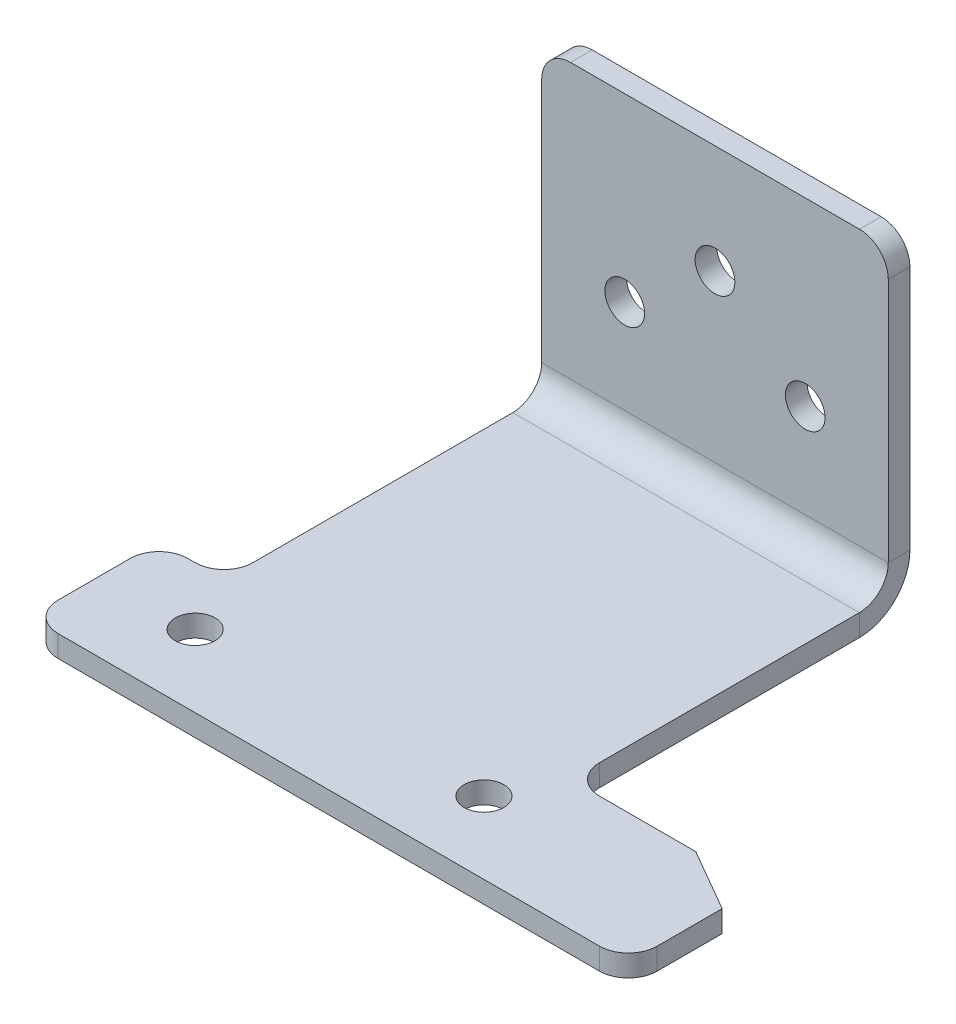
from build123d import *

# Parameters (mm, degrees)
ODGI_CIE_BAZOWE1_DEPTH     = 50
SZKIC6_W                   = 26
SZKIC6_H                   = 47
WYTNIJ_WYCI_GNI_CIE1_DEPTH = 94.541434669
OTW_R_POD_RUB_M51_D        = 5.5
OTW_R_POD_RUB_M52_D        = 5.5
SZKIC11_W                  = 17
SZKIC11_H                  = 18
WYTNIJ_WYCI_GNI_CIE2_DEPTH = 93.135769384
SFAZOWANIE1_SIZE           = 5
SFAZOWANIE1_SIZE2          = 8.660254038
ZAOKR_GLENIE1_R            = 4


# Sheet-metal steps are written as plain solids
with BuildPart() as part:
    # Szkic1 → Odgięcie bazowe1 (new, symmetric)
    with BuildSketch(Plane(origin=(0, 0, 0), x_dir=(0, 0, -1), z_dir=(1, 0, 0))):
        with BuildLine():
            Line((-65, 0), (-7, 0))
            ThreePointArc((-7, 0), (-2.050252532, 2.050252532), (0, 7))
            Line((0, 7), (0, 45))
            Line((0, 45), (-3, 45))
            Line((-3, 45), (-3, 7))
            ThreePointArc((-3, 7), (-4.171572875, 4.171572875), (-7, 3))
            Line((-7, 3), (-65, 3))
            Line((-65, 3), (-65, 0))
        make_face()
    extrude(amount=ODGI_CIE_BAZOWE1_DEPTH, both=True)

    # Szkic6 → Wytnij-wyciągnięcie1 (cut, through all)
    with BuildSketch(Plane.XZ):
        with Locations((37, 23.5)):
            Rectangle(SZKIC6_W, SZKIC6_H)
        with Locations((-37, 23.5)):
            Rectangle(SZKIC6_W, SZKIC6_H)
    extrude(amount=-WYTNIJ_WYCI_GNI_CIE1_DEPTH, mode=Mode.SUBTRACT)

    # Otwór pod śrubę M51 (through all)
    with Locations(Plane(origin=(0, 0, 0), x_dir=(-1, 0, 0), z_dir=(0, 0, -1))):
        with Locations((0, 30), (-12.5, 20), (12.5, 20)):
            Hole(OTW_R_POD_RUB_M51_D / 2)

    # Otwór pod śrubę M52 (through all)
    with Locations(Plane(origin=(0, 0, 0), x_dir=(-1, 0, 0), z_dir=(0, -1, 0))):
        with Locations((20, -55), (-20, -55)):
            Hole(OTW_R_POD_RUB_M52_D / 2)

    # Szkic11 → Wytnij-wyciągnięcie2 (cut, through all)
    with BuildSketch(Plane(origin=(0, 3, 0), x_dir=(1, 0, 0), z_dir=(0, 1, 0))):
        with Locations((-41.5, -56)):
            Rectangle(SZKIC11_W, SZKIC11_H)
    extrude(amount=-WYTNIJ_WYCI_GNI_CIE2_DEPTH, mode=Mode.SUBTRACT)

    # Sfazowanie1
    sfazowanie1_edges = [part.edges().sort_by_distance(p)[0] for p in [
        (50, 1.5, 47),
    ]]
    sfazowanie1_side = [part.faces().sort_by_distance(p)[0] for p in [
        (50, 1.5, 56),
    ]]
    chamfer(sfazowanie1_edges, length=SFAZOWANIE1_SIZE, length2=SFAZOWANIE1_SIZE2, reference=sfazowanie1_side[0])

    # Zaokrąglenie1
    zaokr_glenie1_edges = [part.edges().sort_by_distance(p)[0] for p in [
        (-33, 1.5, 47),
        (-33, 1.5, 65),
        (-24, 45, 1.5),
        (-24, 1.5, 47),
        (24, 1.5, 47),
        (24, 45, 1.5),
        (50, 1.5, 65),
    ]]
    fillet(zaokr_glenie1_edges, radius=ZAOKR_GLENIE1_R)


solid = part.part
